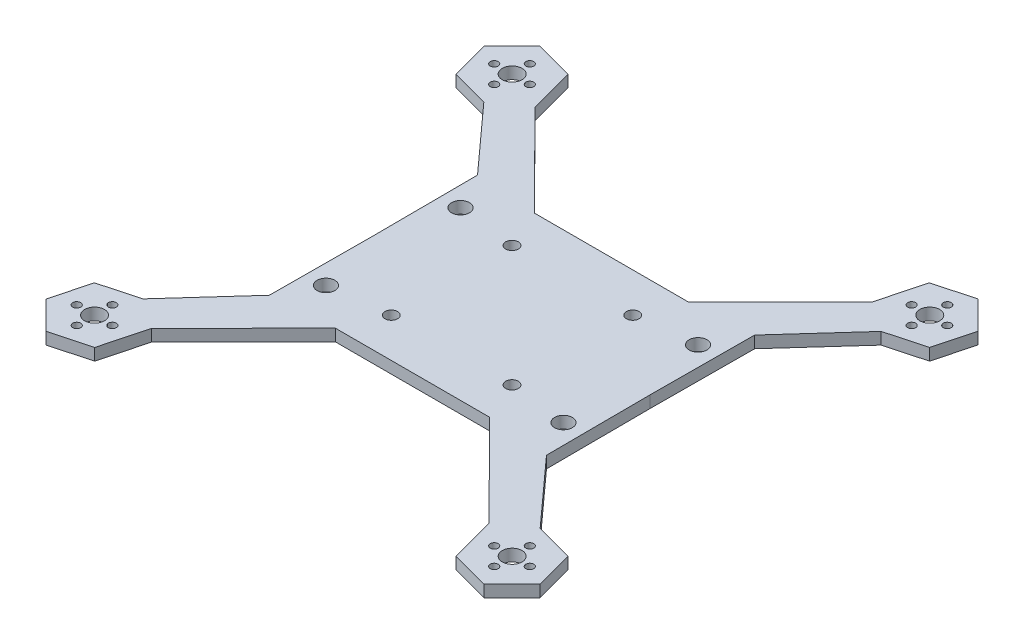
from build123d import *

# Parameters (mm, degrees)
SKETCH1_R           = 1
SKETCH1_R_2         = 2.25
SKETCH1_R_3         = 1.6
BOSS_EXTRUDE1_DEPTH = 3
SKETCH7_R           = 0.75
BOSS_EXTRUDE4_DEPTH = 0.05
SKETCH8_R           = 2.5
CUT_EXTRUDE7_DEPTH  = 10


with BuildPart() as part:
    # Sketch1 → Boss-Extrude1 (new body)
    with BuildSketch(Plane(origin=(0, 0, 0), x_dir=(1, 0, 0), z_dir=(0, 1, 0))):
        Polygon((43.076410298, 50.123925917), (42.618597625, 48.402115535), (19.4637773, 25.158118275), (-19.4637773, 25.158118275), (-42.618597625, 48.402115535), (-45.64603124, 59.788140743), (-55.300297258, 62.394891143), (-62.384942335, 55.337426715), (-59.815321393, 45.673211889), (-50.185022628, 43.072932893), (-35, 26.288270568), (-34.873, 0), (-35, -26.288270568), (-50.185022628, -43.072932893), (-59.815321393, -45.673211889), (-62.384942335, -55.337426715), (-55.300297258, -62.394891143), (-45.64603124, -59.788140743), (-42.618597625, -48.402115535), (-19.4637773, -25.158118275), (19.4637773, -25.158118275), (42.618597625, -48.402115535), (45.64603124, -59.788140743), (55.300297258, -62.394891143), (62.384942335, -55.337426715), (59.815321393, -45.673211889), (50.185022628, -43.072932893), (35, -26.288270568), (34.873, 0), (35, 26.288270568), (50.185022628, 43.072932893), (59.815321393, 45.673211889), (62.384942335, 55.337426715), (55.300297258, 62.394891143), (45.64603124, 59.788140743), align=None)
        with Locations((-52.730676316, -57.230676316)):
            Circle(SKETCH1_R, mode=Mode.SUBTRACT)
        with Locations((-57.230676316, -52.730676316)):
            Circle(SKETCH1_R, mode=Mode.SUBTRACT)
        with Locations((-48.230676316, -52.730676316)):
            Circle(SKETCH1_R, mode=Mode.SUBTRACT)
        with Locations((-52.730676316, -48.230676316)):
            Circle(SKETCH1_R, mode=Mode.SUBTRACT)
        with Locations((-30, -17)):
            Circle(SKETCH1_R_2, mode=Mode.SUBTRACT)
        with Locations((-15.25, -15.25)):
            Circle(SKETCH1_R_3, mode=Mode.SUBTRACT)
        with Locations((52.730676316, -57.230676316)):
            Circle(SKETCH1_R, mode=Mode.SUBTRACT)
        with Locations((48.230676316, -52.730676316)):
            Circle(SKETCH1_R, mode=Mode.SUBTRACT)
        with Locations((52.730676316, -48.230676316)):
            Circle(SKETCH1_R, mode=Mode.SUBTRACT)
        with Locations((57.230676316, -52.730676316)):
            Circle(SKETCH1_R, mode=Mode.SUBTRACT)
        with Locations((30, -17)):
            Circle(SKETCH1_R_2, mode=Mode.SUBTRACT)
        with Locations((15.25, -15.25)):
            Circle(SKETCH1_R_3, mode=Mode.SUBTRACT)
        with Locations((-15.25, 15.25)):
            Circle(SKETCH1_R_3, mode=Mode.SUBTRACT)
        with Locations((-30, 17)):
            Circle(SKETCH1_R_2, mode=Mode.SUBTRACT)
        with Locations((-57.230676316, 52.730676316)):
            Circle(SKETCH1_R, mode=Mode.SUBTRACT)
        with Locations((-52.730676316, 48.230676316)):
            Circle(SKETCH1_R, mode=Mode.SUBTRACT)
        with Locations((-48.230676316, 52.730676316)):
            Circle(SKETCH1_R, mode=Mode.SUBTRACT)
        with Locations((-52.730676316, 57.230676316)):
            Circle(SKETCH1_R, mode=Mode.SUBTRACT)
        with Locations((15.25, 15.25)):
            Circle(SKETCH1_R_3, mode=Mode.SUBTRACT)
        with Locations((30, 17)):
            Circle(SKETCH1_R_2, mode=Mode.SUBTRACT)
        with Locations((52.730676316, 48.230676316)):
            Circle(SKETCH1_R, mode=Mode.SUBTRACT)
        with Locations((48.230676316, 52.730676316)):
            Circle(SKETCH1_R, mode=Mode.SUBTRACT)
        with Locations((57.230676316, 52.730676316)):
            Circle(SKETCH1_R, mode=Mode.SUBTRACT)
        with Locations((52.730676316, 57.230676316)):
            Circle(SKETCH1_R, mode=Mode.SUBTRACT)
    extrude(amount=BOSS_EXTRUDE1_DEPTH)

    # Sketch7 → Boss-Extrude4 (add)
    with BuildSketch(Plane(origin=(0, 3, 0), x_dir=(1, 0, 0), z_dir=(0, 1, 0))):
        with Locations((-52.730676316, -52.730676316)):
            Circle(SKETCH7_R)
        with Locations((-52.730676316, 52.730676316)):
            Circle(SKETCH7_R)
        with Locations((52.730676316, 52.730676316)):
            Circle(SKETCH7_R)
        with Locations((52.730676316, -52.730676316)):
            Circle(SKETCH7_R)
    extrude(amount=BOSS_EXTRUDE4_DEPTH)

    # Sketch8 → Cut-Extrude7 (cut)
    with BuildSketch(Plane(origin=(0, 3, 0), x_dir=(1, 0, 0), z_dir=(0, 1, 0))):
        with Locations((-52.730676316, -52.730676316)):
            Circle(SKETCH8_R)
        with Locations((52.769323684, -52.730676316)):
            Circle(SKETCH8_R)
        with Locations((52.769323684, 52.769323684)):
            Circle(SKETCH8_R)
        with Locations((-52.730676316, 52.769323684)):
            Circle(SKETCH8_R)
    extrude(amount=-CUT_EXTRUDE7_DEPTH, mode=Mode.SUBTRACT)


with BuildPart() as body_2:
    # of the pieces the cut leaves, the one that is kept (cut_extrude7_keep)
    add(part.part.solids().sort_by_distance((-19.4637773, 0, 25.158118275))[0])


solid = body_2.part
